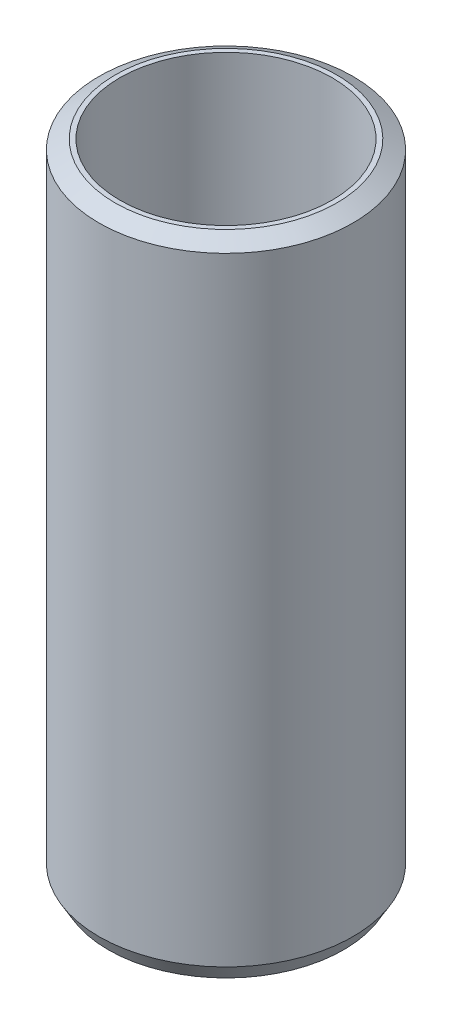
from build123d import *
from OCP.BRepFilletAPI import BRepFilletAPI_MakeChamfer

# Parameters (mm, degrees)
SKETCH1_R           = 55
BOSS_EXTRUDE1_DEPTH = 278.606057331
SKETCH2_R           = 45.956612136
CUT_EXTRUDE1_DEPTH  = 290.259978534
CHAMFER1_SIZE       = 4.030162388
CHAMFER1_SIZE2      = 6.980446019


with BuildPart() as part:
    # Sketch1 → Boss-Extrude1 (new body)
    with BuildSketch(Plane(origin=(0, 0, 0), x_dir=(1, 0, 0), z_dir=(0, 1, 0))):
        Circle(SKETCH1_R)
    extrude(amount=BOSS_EXTRUDE1_DEPTH)

    # Sketch2 → Cut-Extrude1 (cut, through all)
    with BuildSketch(Plane(origin=(0, 0, 0), x_dir=(1, 0, 0), z_dir=(0, 1, 0))):
        Circle(SKETCH2_R)
    extrude(amount=CUT_EXTRUDE1_DEPTH, mode=Mode.SUBTRACT)

    # Chamfer1: one chamfer whose edges measure the first distance from different faces: ONE call of the kernel's chamfer builder (chamfer() names one face for all edges)
    chamfer1_edges_1 = [part.edges().sort_by_distance(p)[0] for p in [
        (-55, 278.606057331, 0),
    ]]
    chamfer1_side_1 = [part.faces().sort_by_distance(p)[0] for p in [
        (-55, 139.303028666, 0),
    ]]
    chamfer1_edges_2 = [part.edges().sort_by_distance(p)[0] for p in [
        (-55, 0, 0),
    ]]
    chamfer1_side_2 = [part.faces().sort_by_distance(p)[0] for p in [
        (-53.444365081, 0, 0),
    ]]
    chamfer1 = BRepFilletAPI_MakeChamfer(part.part.solid().wrapped)
    for e in chamfer1_edges_1:
        chamfer1.Add(CHAMFER1_SIZE, CHAMFER1_SIZE2, e.wrapped, chamfer1_side_1[0].wrapped)  # the first distance lies on this face
    for e in chamfer1_edges_2:
        chamfer1.Add(CHAMFER1_SIZE, CHAMFER1_SIZE2, e.wrapped, chamfer1_side_2[0].wrapped)  # the first distance lies on this face
    add(Compound.cast(chamfer1.Shape()), mode=Mode.REPLACE)


solid = part.part
